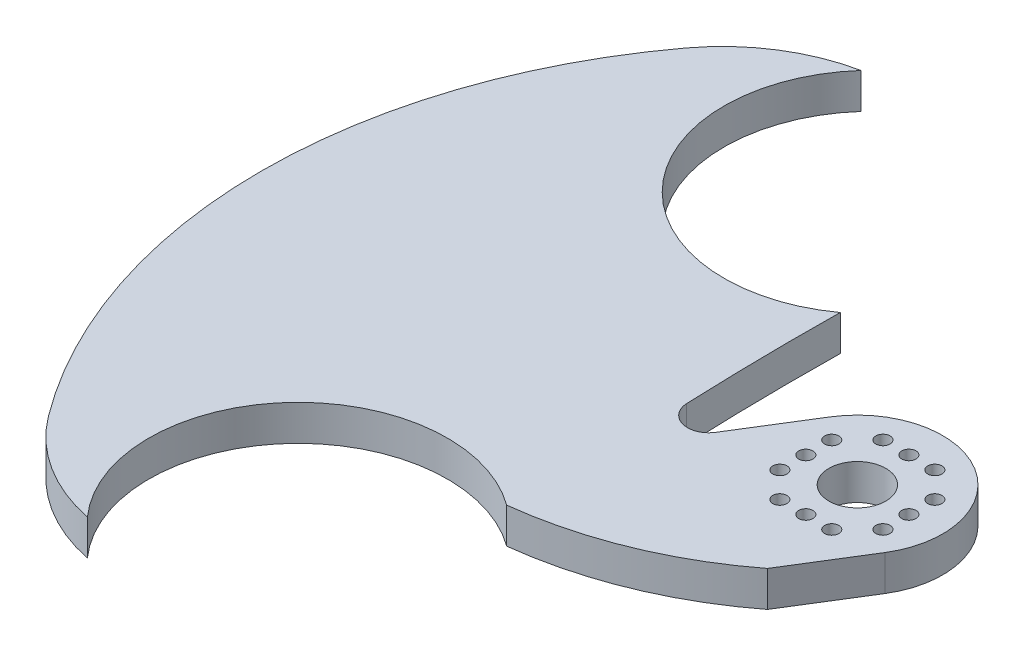
from build123d import *

# Parameters (mm, degrees)
ESQUISSE1_R        = 4
ESQUISSE1_R_2      = 1
BOSS_EXTRU_1_DEPTH = 5


with BuildPart() as part:
    # Esquisse1 → Boss.-Extru.1 (new body)
    with BuildSketch(Plane(origin=(0, 0, 0), x_dir=(1, 0, 0), z_dir=(0, 1, 0))):
        with BuildLine():
            Line((-10.196358847, 6.327263726), (-16.345353916, -3.581815931))
            ThreePointArc((-16.345353916, -3.581815931), (-19.657727861, -4.901275095), (-21.891937923, -2.122588528))
            ThreePointArc((-21.891937923, -2.122588528), (-22.188049449, 8.824903375), (-22.181224531, 19.776397083))
            ThreePointArc((-22.181224531, 19.776397083), (-50.086669819, 22.665947401), (-50.217590666, 50.720291761))
            ThreePointArc((-50.217590666, 50.720291761), (-58.601303894, 47.333613219), (-65.231992794, 41.186239492))
            ThreePointArc((-65.231992794, 41.186239492), (-80.136014412, -3.685504203), (-65.231992794, -48.557247898))
            ThreePointArc((-65.231992794, -48.557247898), (-58.601303894, -54.704621625), (-50.217590666, -58.091300168))
            ThreePointArc((-50.217590666, -58.091300168), (-50.086669819, -30.036955808), (-22.181224531, -27.14740549))
            ThreePointArc((-22.181224531, -27.14740549), (-8.43118949, -23.612962912), (3.869095122, -16.523622573))
            Line((3.869095122, -16.523622573), (10.196358847, -6.327263726))
            ThreePointArc((10.196358847, -6.327263726), (6.327263726, 10.196358847), (-10.196358847, 6.327263726))
        make_face()
        Circle(ESQUISSE1_R, mode=Mode.SUBTRACT)
        with Locations((7.25, -3.65)):
            Circle(ESQUISSE1_R_2, mode=Mode.SUBTRACT)
        with Locations((7.25, 0)):
            Circle(ESQUISSE1_R_2, mode=Mode.SUBTRACT)
        with Locations((7.25, 3.65)):
            Circle(ESQUISSE1_R_2, mode=Mode.SUBTRACT)
        with Locations((3.65, -7.25)):
            Circle(ESQUISSE1_R_2, mode=Mode.SUBTRACT)
        with Locations((0, -7.25)):
            Circle(ESQUISSE1_R_2, mode=Mode.SUBTRACT)
        with Locations((-3.65, -7.25)):
            Circle(ESQUISSE1_R_2, mode=Mode.SUBTRACT)
        with Locations((-7.25, -3.65)):
            Circle(ESQUISSE1_R_2, mode=Mode.SUBTRACT)
        with Locations((-7.25, 0)):
            Circle(ESQUISSE1_R_2, mode=Mode.SUBTRACT)
        with Locations((-7.25, 3.65)):
            Circle(ESQUISSE1_R_2, mode=Mode.SUBTRACT)
        with Locations((-3.65, 7.25)):
            Circle(ESQUISSE1_R_2, mode=Mode.SUBTRACT)
        with Locations((0, 7.25)):
            Circle(ESQUISSE1_R_2, mode=Mode.SUBTRACT)
        with Locations((3.65, 7.25)):
            Circle(ESQUISSE1_R_2, mode=Mode.SUBTRACT)
    extrude(amount=BOSS_EXTRU_1_DEPTH)


solid = part.part
